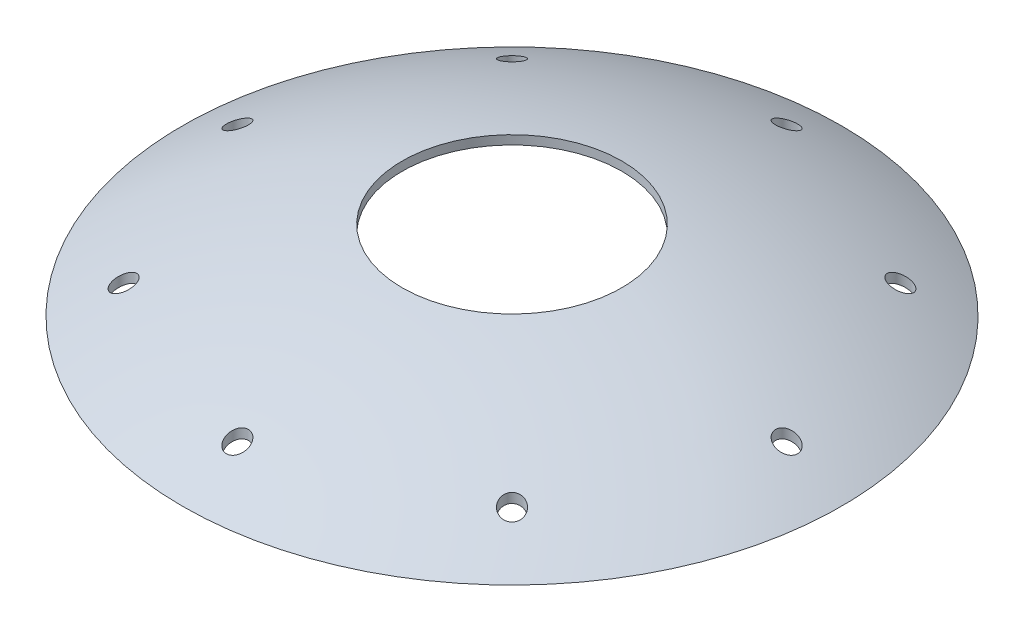
from build123d import *

# Parameters (mm, degrees)
SKETCH4_R          = 25
CUT_EXTRUDE1_DEPTH = 22
SKETCH5_R          = 2.5
CUT_EXTRUDE2_DEPTH = 32


# Read off the part's stored shape, not the designer's step: Shell4
with BuildPart() as part:
    # Sketch2 → Revolve3 (revolve)
    with BuildSketch(Plane.XY):
        with BuildLine():
            ThreePointArc((-75, 0), (-38.854521396, 15.079455235), (0, 20))
            Line((0, 20), (0, 0))
            Line((0, 0), (-75, 0))
        make_face()
    revolve(axis=Axis((0, 20, 0), (0, -1, 0)))

    # Shell4 outline → Shell4 (revolve, cut)
    with BuildSketch(Plane.XY):
        with BuildLine():
            Line((0, 0), (70.959299581, 0))
            add(Edge.make_bspline(
                [(70.959299581, 0), (58.371091625, 6.969352493), (44.697655968, 12.48291706), (30.310219449, 16.202186231), (15.668630532, 18.005474405), (1.010939764, 18.005474483), (0.758094755, 18.004918806), (0.505321529, 18.00380806), (0.252622481, 18.002142877), (0, 17.999923905)],
                knots=[1.06516175, 1.06516175, 1.06516175, 1.06516175, 1.06516175, 1.06516175, 1.570703705, 1.570703705, 1.570703705, 1.570703705, 1.579579846, 1.579579846, 1.579579846, 1.579579846, 1.579579846, 1.579579846], degree=5, weights=[1, 1, 0.999596269, 0.999595367, 1, 1, 1, 1, 1, 1]))
            Line((0, 17.999923905), (0, 0))
        make_face()
    revolve(axis=Axis((0, 0, 0), (0, 1, 0)), mode=Mode.SUBTRACT)

    # Sketch4 → Cut-Extrude1 (cut)
    with BuildSketch(Plane(origin=(0, 0, 0), x_dir=(1, 0, 0), z_dir=(0, 1, 0))):
        with Locations(Location((0, 0, 0), (0, 0, 90))):
            Circle(SKETCH4_R)
    extrude(amount=CUT_EXTRUDE1_DEPTH, mode=Mode.SUBTRACT)

    # Sketch5 → Cut-Extrude2 (cut)
    with BuildSketch(Plane(origin=(0, 0, 0), x_dir=(1, 0, 0), z_dir=(0, 1, 0))):
        with Locations(Location((0, 62.5, 0), (0, 0, 131.964554843))):
            Circle(SKETCH5_R)
        with Locations(Location((44.194173824, 44.194173824, 0), (0, 0, 123.165535586))):
            Circle(SKETCH5_R)
        with Locations(Location((62.5, 0, 0), (0, 0, 119.349424952))):
            Circle(SKETCH5_R)
        with Locations(Location((44.194173824, -44.194173824, 0), (0, 0, 135))):
            Circle(SKETCH5_R)
        with Locations(Location((0, -62.5, 0), (0, 0, 90))):
            Circle(SKETCH5_R)
        with Locations(Location((-44.194173824, -44.194173824, 0), (0, 0, 142.679889027))):
            Circle(SKETCH5_R)
        with Locations(Location((-62.5, 0, 0), (0, 0, 135.297757313))):
            Circle(SKETCH5_R)
        with Locations(Location((-44.194173824, 44.194173824, 0), (0, 0, 135))):
            Circle(SKETCH5_R)
    extrude(amount=CUT_EXTRUDE2_DEPTH, mode=Mode.SUBTRACT)


solid = part.part
